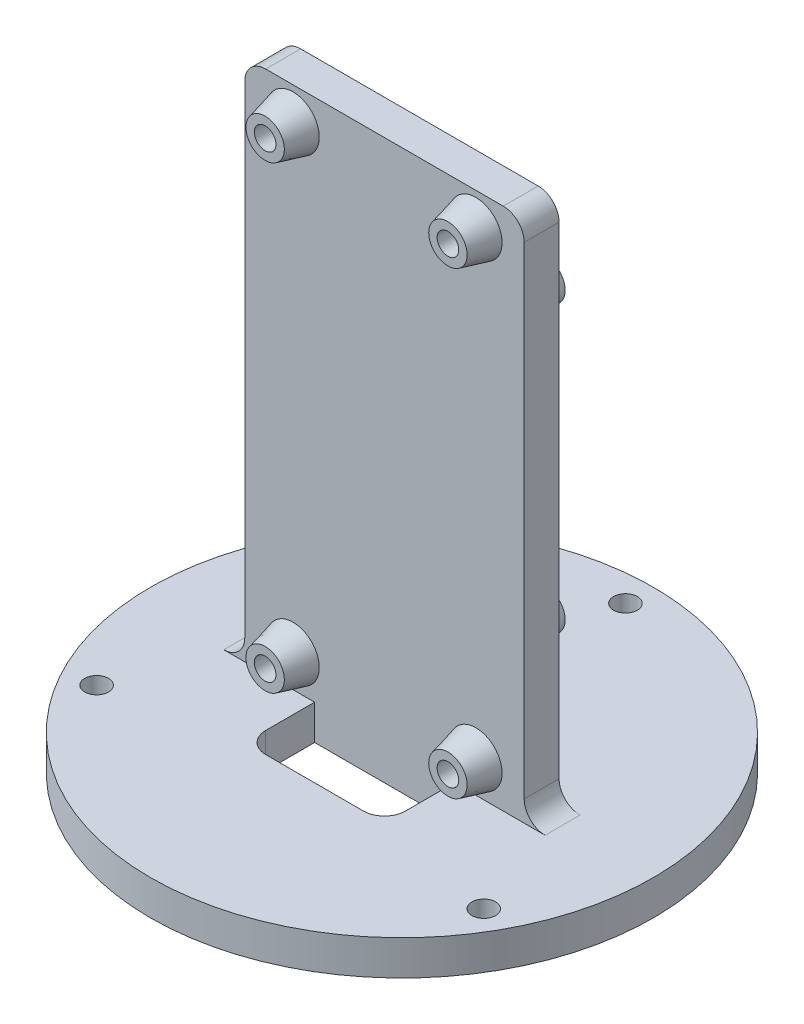
from build123d import *
from OCP.BRepFilletAPI import BRepFilletAPI_MakeChamfer

# Parameters (mm, degrees)
SKETCH1_R           = 36
SKETCH1_R_2         = 1.7
BOSS_EXTRUDE1_DEPTH = 5
SKETCH2_W           = 40
SKETCH2_H           = 75
BOSS_EXTRUDE2_DEPTH = 2.5
SKETCH3_R           = 2.75
SKETCH3_R_2         = 1.55
BOSS_EXTRUDE3_DEPTH = 4
SKETCH4_R           = 2.75
SKETCH4_R_2         = 1.55
BOSS_EXTRUDE4_DEPTH = 4
CHAMFER1_SIZE       = 1
CHAMFER1_SIZE_2     = 4
SKETCH6_W           = 20
SKETCH6_H           = 10
CUT_EXTRUDE1_DEPTH  = 91.647669578
FILLET1_R           = 3


with BuildPart() as part:
    # Sketch1 → Boss-Extrude1 (new body)
    with BuildSketch(Plane(origin=(0, 0, 0), x_dir=(1, 0, 0), z_dir=(0, 1, 0))):
        with Locations(Location((0, 0, 0), (0, 0, 270))):
            Circle(SKETCH1_R)
        with Locations(Location((0, 32, 0), (0, 0, 270))):
            Circle(SKETCH1_R_2, mode=Mode.SUBTRACT)
        with Locations(Location((27.712812921, -16, 0), (0, 0, 270))):
            Circle(SKETCH1_R_2, mode=Mode.SUBTRACT)
        with Locations(Location((-27.712812921, -16, 0), (0, 0, 270))):
            Circle(SKETCH1_R_2, mode=Mode.SUBTRACT)
    extrude(amount=BOSS_EXTRUDE1_DEPTH)

    # Sketch2 → Boss-Extrude2 (add, symmetric)
    with BuildSketch(Plane.XY):
        with Locations((0, 42.5)):
            Rectangle(SKETCH2_W, SKETCH2_H)
    extrude(amount=BOSS_EXTRUDE2_DEPTH, both=True)

    # Sketch3 → Boss-Extrude3 (add)
    # profile 1 of 4: a face of its own
    with BuildSketch(Plane.XY.offset(2.5)):
        with Locations(Location((-13.085, 75.375, 0), (0, 0, 180))):
            Circle(SKETCH3_R)
        with Locations((-13.085, 75.375)):
            Circle(SKETCH3_R_2, mode=Mode.SUBTRACT)
    # profile 2 of 4: a face of its own
    with BuildSketch(Plane.XY.offset(2.5)):
        with Locations(Location((13.085, 75.375, 0), (0, 0, 180))):
            Circle(SKETCH3_R)
        with Locations((13.085, 75.375)):
            Circle(SKETCH3_R_2, mode=Mode.SUBTRACT)
    # profile 3 of 4: a face of its own
    with BuildSketch(Plane.XY.offset(2.5)):
        with Locations(Location((13.085, 9.625, 0), (0, 0, 180))):
            Circle(SKETCH3_R)
        with Locations((13.085, 9.625)):
            Circle(SKETCH3_R_2, mode=Mode.SUBTRACT)
    # profile 4 of 4: a face of its own
    with BuildSketch(Plane.XY.offset(2.5)):
        with Locations(Location((-13.085, 9.625, 0), (0, 0, 180))):
            Circle(SKETCH3_R)
        with Locations((-13.085, 9.625)):
            Circle(SKETCH3_R_2, mode=Mode.SUBTRACT)
    extrude(amount=BOSS_EXTRUDE3_DEPTH)

    # Sketch4 → Boss-Extrude4 (add)
    # profile 1 of 4: a face of its own
    with BuildSketch(Plane(origin=(0, 0, -2.5), x_dir=(-1, 0, 0), z_dir=(0, 0, -1))):
        with Locations((-14.125, 65)):
            Circle(SKETCH4_R)
        with Locations((-14.125, 65)):
            Circle(SKETCH4_R_2, mode=Mode.SUBTRACT)
    # profile 2 of 4: a face of its own
    with BuildSketch(Plane(origin=(0, 0, -2.5), x_dir=(-1, 0, 0), z_dir=(0, 0, -1))):
        with Locations((14.125, 65)):
            Circle(SKETCH4_R)
        with Locations((14.125, 65)):
            Circle(SKETCH4_R_2, mode=Mode.SUBTRACT)
    # profile 3 of 4: a face of its own
    with BuildSketch(Plane(origin=(0, 0, -2.5), x_dir=(-1, 0, 0), z_dir=(0, 0, -1))):
        with Locations((14.125, 24.15)):
            Circle(SKETCH4_R)
        with Locations((14.125, 24.15)):
            Circle(SKETCH4_R_2, mode=Mode.SUBTRACT)
    # profile 4 of 4: a face of its own
    with BuildSketch(Plane(origin=(0, 0, -2.5), x_dir=(-1, 0, 0), z_dir=(0, 0, -1))):
        with Locations((-14.125, 24.15)):
            Circle(SKETCH4_R)
        with Locations((-14.125, 24.15)):
            Circle(SKETCH4_R_2, mode=Mode.SUBTRACT)
    extrude(amount=BOSS_EXTRUDE4_DEPTH)

    # Chamfer1
    chamfer1_edges_1 = [part.edges().sort_by_distance(p)[0] for p in [
        (-10.335, 75.375, 2.5),
    ]]
    chamfer1_side_1 = [part.faces().sort_by_distance(p)[0] for p in [
        (-10.315, 75.375, 2.5),
    ]]
    chamfer1_edges_2 = [part.edges().sort_by_distance(p)[0] for p in [
        (15.835, 75.375, 2.5),
    ]]
    chamfer1_side_2 = [part.faces().sort_by_distance(p)[0] for p in [
        (15.855, 75.375, 2.5),
    ]]
    chamfer1_edges_3 = [part.edges().sort_by_distance(p)[0] for p in [
        (15.835, 9.625, 2.5),
    ]]
    chamfer1_side_3 = [part.faces().sort_by_distance(p)[0] for p in [
        (15.855, 9.625, 2.5),
    ]]
    chamfer1_edges_4 = [part.edges().sort_by_distance(p)[0] for p in [
        (-10.335, 9.625, 2.5),
    ]]
    chamfer1_side_4 = [part.faces().sort_by_distance(p)[0] for p in [
        (-10.315, 9.625, 2.5),
    ]]
    chamfer1_edges_5 = [part.edges().sort_by_distance(p)[0] for p in [
        (-11.375, 65, -2.5),
    ]]
    chamfer1_side_5 = [part.faces().sort_by_distance(p)[0] for p in [
        (-11.355, 65, -2.5),
    ]]
    chamfer1_edges_6 = [part.edges().sort_by_distance(p)[0] for p in [
        (16.875, 65, -2.5),
    ]]
    chamfer1_side_6 = [part.faces().sort_by_distance(p)[0] for p in [
        (16.895, 65, -2.5),
    ]]
    chamfer1_edges_7 = [part.edges().sort_by_distance(p)[0] for p in [
        (-11.375, 24.15, -2.5),
    ]]
    chamfer1_side_7 = [part.faces().sort_by_distance(p)[0] for p in [
        (-11.355, 24.15, -2.5),
    ]]
    chamfer1_edges_8 = [part.edges().sort_by_distance(p)[0] for p in [
        (16.875, 24.15, -2.5),
    ]]
    chamfer1_side_8 = [part.faces().sort_by_distance(p)[0] for p in [
        (16.895, 24.15, -2.5),
    ]]
    chamfer1 = BRepFilletAPI_MakeChamfer(part.part.solid().wrapped)
    for e in chamfer1_edges_1:
        chamfer1.Add(CHAMFER1_SIZE - 0.0001, CHAMFER1_SIZE_2 - 0.0001, e.wrapped, chamfer1_side_1[0].wrapped)
    for e in chamfer1_edges_2:
        chamfer1.Add(CHAMFER1_SIZE - 0.0001, CHAMFER1_SIZE_2 - 0.0001, e.wrapped, chamfer1_side_2[0].wrapped)
    for e in chamfer1_edges_3:
        chamfer1.Add(CHAMFER1_SIZE - 0.0001, CHAMFER1_SIZE_2 - 0.0001, e.wrapped, chamfer1_side_3[0].wrapped)
    for e in chamfer1_edges_4:
        chamfer1.Add(CHAMFER1_SIZE - 0.0001, CHAMFER1_SIZE_2 - 0.0001, e.wrapped, chamfer1_side_4[0].wrapped)
    for e in chamfer1_edges_5:
        chamfer1.Add(CHAMFER1_SIZE - 0.0001, CHAMFER1_SIZE_2 - 0.0001, e.wrapped, chamfer1_side_5[0].wrapped)
    for e in chamfer1_edges_6:
        chamfer1.Add(CHAMFER1_SIZE - 0.0001, CHAMFER1_SIZE_2 - 0.0001, e.wrapped, chamfer1_side_6[0].wrapped)
    for e in chamfer1_edges_7:
        chamfer1.Add(CHAMFER1_SIZE - 0.0001, CHAMFER1_SIZE_2 - 0.0001, e.wrapped, chamfer1_side_7[0].wrapped)
    for e in chamfer1_edges_8:
        chamfer1.Add(CHAMFER1_SIZE - 0.0001, CHAMFER1_SIZE_2 - 0.0001, e.wrapped, chamfer1_side_8[0].wrapped)
    add(Compound.cast(chamfer1.Shape()), mode=Mode.REPLACE)  # a hair under: the kernel refuses the full size

    # Sketch6 → Cut-Extrude1 (cut, through all)
    with BuildSketch(Plane(origin=(0, 5, 0), x_dir=(1, 0, 0), z_dir=(0, 1, 0))):
        with Locations((0, 7.5)):
            Rectangle(SKETCH6_W, SKETCH6_H)
        with Locations((0, -7.5)):
            Rectangle(SKETCH6_W, SKETCH6_H)
    extrude(amount=-CUT_EXTRUDE1_DEPTH, mode=Mode.SUBTRACT)

    # Fillet1
    fillet1_edges = [part.edges().sort_by_distance(p)[0] for p in [
        (-10, 2.5, -12.5),
        (10, 2.5, -12.5),
        (-10, 2.5, 12.5),
        (10, 2.5, 12.5),
        (-20, 80, 0),
        (-20, 5, 0),
        (20, 5, 0),
        (20, 80, 0),
    ]]
    fillet(fillet1_edges, radius=FILLET1_R)


solid = part.part
